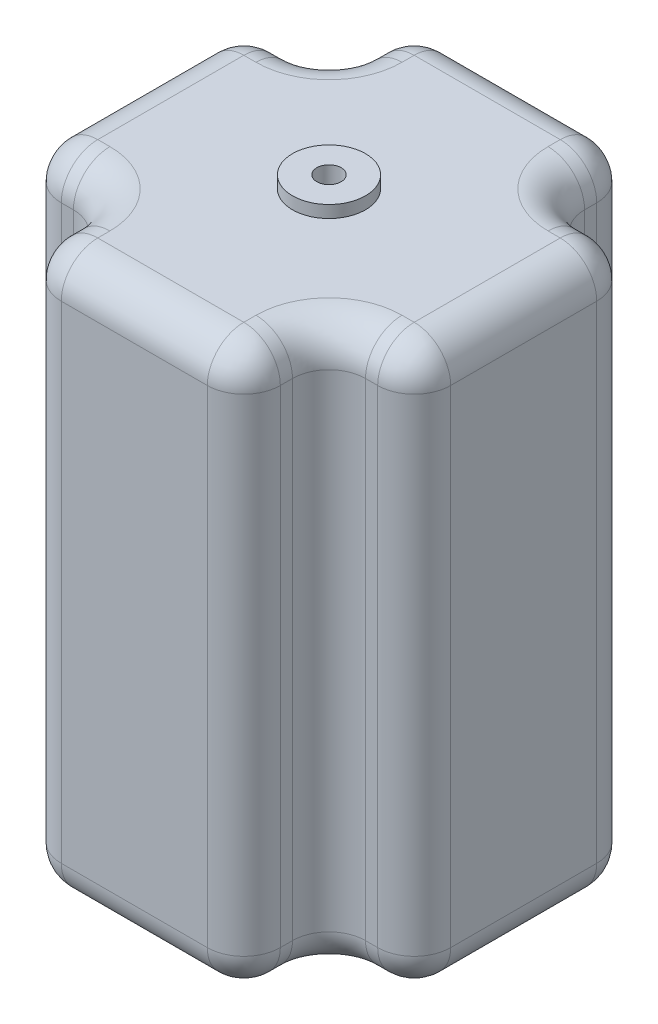
from build123d import *

# Parameters (mm, degrees)
BOSS_EXTRUDE1_DEPTH = 46
FILLET1_R           = 3
SKETCH2_R           = 3
BOSS_EXTRUDE2_DEPTH = 1
SHELL1_T            = -2


with BuildPart() as part:
    # Sketch1 → Boss-Extrude1 (new body)
    with BuildSketch(Plane(origin=(0, 0, 0), x_dir=(1, 0, 0), z_dir=(0, 1, 0))):
        Polygon((-9, 9), (-9, 16), (9, 16), (9, 9), (16, 9), (16, -9), (9, -9), (9, -16), (-9, -16), (-9, -9), (-16, -9), (-16, 9), align=None)
    extrude(amount=BOSS_EXTRUDE1_DEPTH)

    # Fillet1
    fillet1_edges = [part.edges().sort_by_distance(p)[0] for p in [
        (9, 23, 16),
        (-9, 23, 16),
        (-16, 0, 0),
        (-9, 0, 12.5),
        (0, 0, 16),
        (9, 0, 12.5),
        (-9, 0, -12.5),
        (-9, 23, -9),
        (-16, 23, -9),
        (-12.5, 0, -9),
        (-9, 23, -16),
        (0, 0, -16),
        (9, 23, -16),
        (9, 0, -12.5),
        (9, 23, -9),
        (12.5, 0, -9),
        (12.5, 46, -9),
        (9, 46, 12.5),
        (0, 46, 16),
        (-9, 46, 12.5),
        (-16, 46, 0),
        (-12.5, 46, -9),
        (-9, 46, -12.5),
        (0, 46, -16),
        (9, 46, -12.5),
        (-16, 23, 9),
        (-12.5, 46, 9),
        (-9, 23, 9),
        (-12.5, 0, 9),
        (16, 46, 0),
        (16, 23, -9),
        (16, 0, 0),
        (9, 23, 9),
        (12.5, 46, 9),
        (16, 23, 9),
        (12.5, 0, 9),
    ]]
    fillet(fillet1_edges, radius=FILLET1_R)

    # Sketch2 → Boss-Extrude2 (add)
    with BuildSketch(Plane(origin=(0, 46, 0), x_dir=(1, 0, 0), z_dir=(0, 1, 0))):
        Circle(SKETCH2_R)
    extrude(amount=BOSS_EXTRUDE2_DEPTH)

    # Shell1
    shell1_openings = [part.faces().sort_by_distance(p)[0] for p in [
        (0, 47, 0),
    ]]
    offset(amount=SHELL1_T, openings=shell1_openings, kind=Kind.INTERSECTION)


solid = part.part
